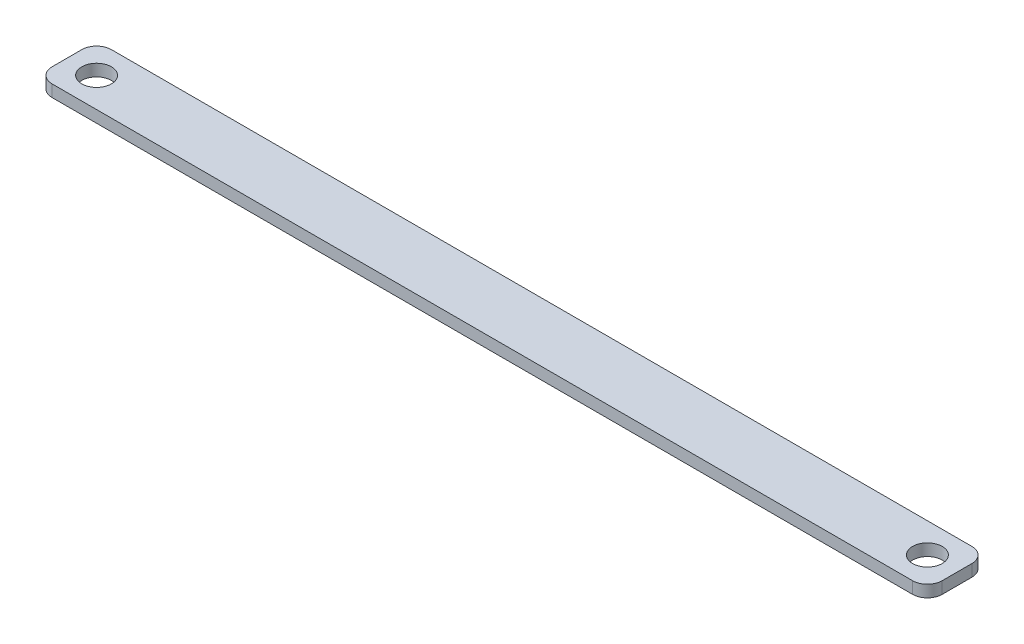
from build123d import *

# Parameters (mm, degrees)
SKETCH1_R           = 2.5
BOSS_EXTRUDE2_DEPTH = 2
FLEX1_OUTLINE_R     = 2.5
FLEX1_DEPTH         = 2


# Read off the part's stored shape, not the designer's step: Flex1
with BuildPart() as part:
    # Sketch1 → Boss-Extrude2 (new body)
    with BuildSketch(Plane(origin=(0, 0, 0), x_dir=(1, 0, 0), z_dir=(0, 1, 0))):
        with BuildLine():
            Line((2.5, 0), (47.5, 0))
            ThreePointArc((47.5, 0), (49.267766953, 0.732233047), (50, 2.5))
            Line((50, 2.5), (50, 7.5))
            ThreePointArc((50, 7.5), (49.267766953, 9.267766953), (47.5, 10))
            Line((47.5, 10), (2.5, 10))
            ThreePointArc((2.5, 10), (0.732233047, 9.267766953), (0, 7.5))
            Line((0, 7.5), (0, 2.5))
            ThreePointArc((0, 2.5), (0.732233047, 0.732233047), (2.5, 0))
        make_face()
        with Locations(Location((5, 5, 0), (0, 0, 270))):
            Circle(SKETCH1_R, mode=Mode.SUBTRACT)
        with Locations(Location((45, 5, 0), (0, 0, 270))):
            Circle(SKETCH1_R, mode=Mode.SUBTRACT)
    extrude(amount=BOSS_EXTRUDE2_DEPTH)

    # Flex1 outline → Flex1 (add)
    # profile 1 of 4: a face of its own
    with BuildSketch(Plane(origin=(0, 0, 0), x_dir=(1, 0, 0), z_dir=(0, 1, 0))):
        with BuildLine():
            Line((2.5, 10), (-46.292510667, 10))
            ThreePointArc((-46.292510667, 10), (-48.06027762, 9.267766953), (-48.792510667, 7.5))
            Line((-48.792510667, 7.5), (-48.792510667, 2.5))
            ThreePointArc((-48.792510667, 2.5), (-48.06027762, 0.732233047), (-46.292510667, 0))
            Line((-46.292510667, 0), (2.5, 0))
            ThreePointArc((2.5, 0), (0.732233047, 0.732233047), (0, 2.5))
            Line((0, 2.5), (0, 7.5))
            ThreePointArc((0, 7.5), (0.732233047, 9.267766953), (2.5, 10))
        make_face()
        with Locations((-43.792510667, 5)):
            Circle(FLEX1_OUTLINE_R, mode=Mode.SUBTRACT)
    # profile 2 of 4: a face of its own
    with BuildSketch(Plane(origin=(0, 0, 0), x_dir=(1, 0, 0), z_dir=(0, 1, 0))):
        with BuildLine():
            Line((98.707489333, 10), (47.5, 10))
            ThreePointArc((47.5, 10), (49.267766953, 9.267766953), (50, 7.5))
            Line((50, 7.5), (50, 2.5))
            ThreePointArc((50, 2.5), (49.267766953, 0.732233047), (47.5, 0))
            Line((47.5, 0), (98.707489333, 0))
            ThreePointArc((98.707489333, 0), (100.475256286, 0.732233047), (101.207489333, 2.5))
            Line((101.207489333, 2.5), (101.207489333, 7.5))
            ThreePointArc((101.207489333, 7.5), (100.475256286, 9.267766953), (98.707489333, 10))
        make_face()
        with Locations((96.207489333, 5)):
            Circle(FLEX1_OUTLINE_R, mode=Mode.SUBTRACT)
    # profile 3 of 4: a face of its own
    with BuildSketch(Plane(origin=(0, 0, 0), x_dir=(1, 0, 0), z_dir=(0, 1, 0))):
        with Locations((5, 5)):
            Circle(FLEX1_OUTLINE_R)
    # profile 4 of 4: a face of its own
    with BuildSketch(Plane(origin=(0, 0, 0), x_dir=(1, 0, 0), z_dir=(0, 1, 0))):
        with Locations((45, 5)):
            Circle(FLEX1_OUTLINE_R)
    extrude(amount=FLEX1_DEPTH)


solid = part.part
